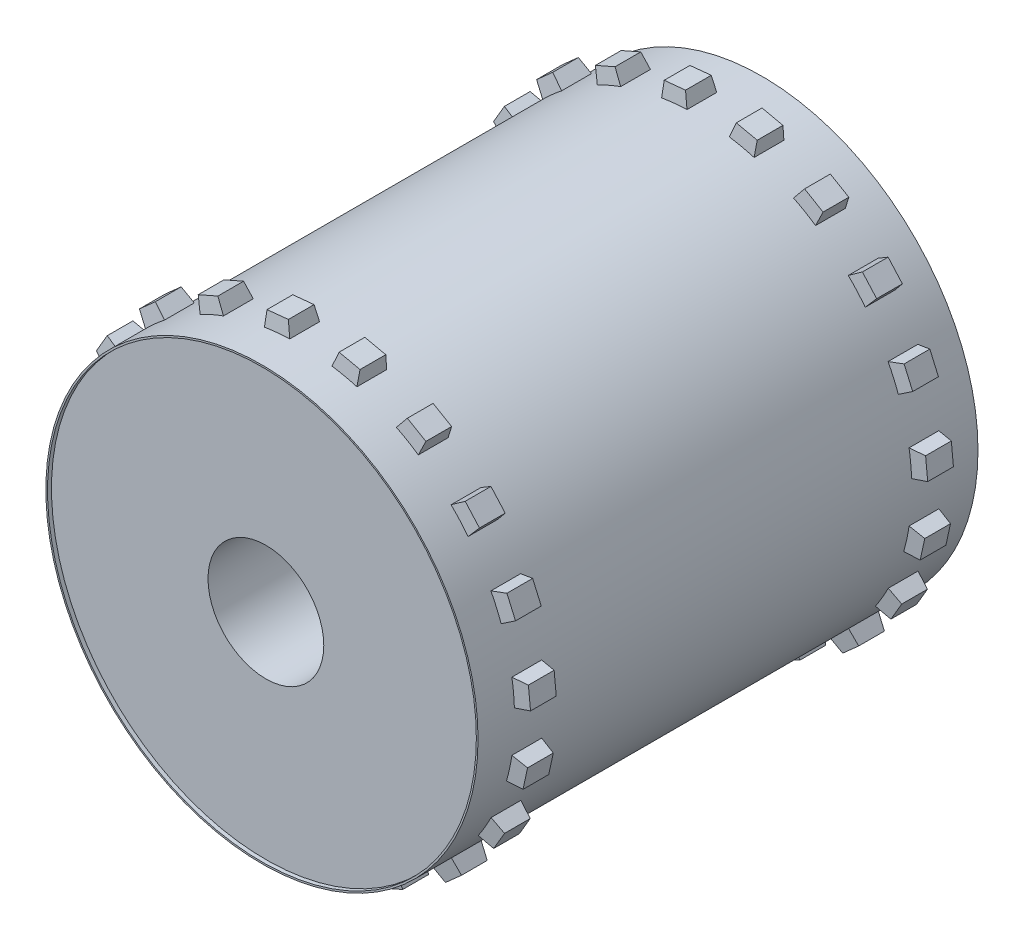
from build123d import *

# Parameters (mm, degrees)
PROFILE_SKETCH_R           = 15.12
PROFILE_EXTRUDE_DEPTH      = 34.98
BORE_SKETCH_R              = 4.05
BORE_CUT_DEPTH             = 41.99791702
BEARING_POCKET_1_SKETCH_R  = 15.00189
BEARING_POCKET_1_CUT_DEPTH = 0.275787
BEARING_START              = -0.275787
BEARING_POCKET_2_SKETCH_R  = 15.00189
BEARING_POCKET_2_CUT_DEPTH = 0.275787
BOSS_EXTRUDE1_DEPTH        = 1.8
DRAFT1_ANGLE               = 8


with BuildPart() as part:
    # Profile Sketch → Profile Extrude (new body)
    with BuildSketch(Plane.XY):
        Circle(PROFILE_SKETCH_R)
    extrude(amount=PROFILE_EXTRUDE_DEPTH)

    # Bore Sketch → Bore Cut (cut, through all)
    with BuildSketch(Plane(origin=(0, 0, 0), x_dir=(-1, 0, 0), z_dir=(0, 0, -1))):
        Circle(BORE_SKETCH_R)
    extrude(amount=-BORE_CUT_DEPTH, mode=Mode.SUBTRACT)

    # Bearing Pocket 1 Sketch → Bearing Pocket 1 Cut (cut)
    with BuildSketch(Plane(origin=(0, 0, 0), x_dir=(-1, 0, 0), z_dir=(0, 0, -1))):
        Circle(BEARING_POCKET_1_SKETCH_R)
    extrude(amount=-BEARING_POCKET_1_CUT_DEPTH, mode=Mode.SUBTRACT)

    # Bearing Pocket 2 Sketch → Bearing Pocket 2 Cut (cut)
    with BuildSketch(Plane.XY.offset(34.98).offset(BEARING_START)):
        with Locations(Location((0, 0, 0), (0, 0, 180))):
            Circle(BEARING_POCKET_2_SKETCH_R)
    extrude(amount=BEARING_POCKET_2_CUT_DEPTH, mode=Mode.SUBTRACT)

    # 3DSketch1 → Boss-Extrude1 (add)
    with BuildSketch(Plane(origin=(-2.240587225, 14.953065535, 32.285), x_dir=(0.7730799543925518, 0.6343085874528346, 0), z_dir=(0, 0, 1))):
        Polygon((0, 0), (0.554700196, 0.832050294), (1.802775638, 0), (1.248075442, -0.832050294), align=None)
    extrude(amount=-BOSS_EXTRUDE1_DEPTH)

    # Draft1
    draft1_faces = [part.faces().sort_by_distance(p)[0] for p in [
        (-1.544354806, 15.530982586, 30.485),
        (-0.797422995, 15.599035352, 31.385),
        (-1.544354806, 15.530982586, 32.285),
        (-2.290061748, 15.450611785, 31.385),
    ]]
    draft(draft1_faces, Plane(origin=(-2.33953627, 15.948158036, 32.285), x_dir=(0.9950925015264446, 0.09894904449181359, 0), z_dir=(-0.09894904449181359, 0.9950925015264446, 0)), DRAFT1_ANGLE)

    # CirPattern1: read off the stored shape, not the designer's step
    # CirPattern1: loft between two sections, ruled curve by curve
    cirpattern1_from = [
        Edge.make_line((2.349822398, 14.936289188, 30.34337705), (4.091993269, 14.555754569, 30.34337705)),
        Edge.make_line((2.349822398, 14.936289188, 30.34337705), (2.349822398, 14.936289188, 32.42662295)),
        Edge.make_line((2.349822398, 14.936289188, 32.42662295), (4.091993269, 14.555754569, 32.42662295)),
        Edge.make_line((4.091993269, 14.555754569, 30.34337705), (4.091993269, 14.555754569, 32.42662295)),
    ]
    cirpattern1_to = [
        Edge.make_line((2.703220648, 15.89055609, 30.485), (4.168669864, 15.570464549, 30.485)),
        Edge.make_line((2.703220648, 15.89055609, 30.485), (2.703220648, 15.89055609, 32.285)),
        Edge.make_line((2.703220648, 15.89055609, 32.285), (4.168669864, 15.570464549, 32.285)),
        Edge.make_line((4.168669864, 15.570464549, 30.485), (4.168669864, 15.570464549, 32.285)),
    ]
    cirpattern1 = Solid(Shell([*[Face.make_surface_from_curves(cirpattern1_from[k], cirpattern1_to[k]) for k in range(4)], Face(Wire(cirpattern1_from)), Face(Wire(cirpattern1_to))]))
    add(cirpattern1)

    # CirPattern1 2: loft between two sections, ruled curve by curve
    cirpattern1_2_from = [
        Edge.make_line((6.850381096, 13.479120106, 30.34337705), (8.389692391, 12.578849772, 30.34337705)),
        Edge.make_line((6.850381096, 13.479120106, 30.34337705), (6.850381096, 13.479120106, 32.42662295)),
        Edge.make_line((6.850381096, 13.479120106, 32.42662295), (8.389692391, 12.578849772, 32.42662295)),
        Edge.make_line((8.389692391, 12.578849772, 30.34337705), (8.389692391, 12.578849772, 32.42662295)),
    ]
    cirpattern1_2_to = [
        Edge.make_line((7.481367494, 14.277475797, 30.485), (8.776178794, 13.520201939, 30.485)),
        Edge.make_line((7.481367494, 14.277475797, 30.485), (7.481367494, 14.277475797, 32.285)),
        Edge.make_line((7.481367494, 14.277475797, 32.285), (8.776178794, 13.520201939, 32.285)),
        Edge.make_line((8.776178794, 13.520201939, 30.485), (8.776178794, 13.520201939, 32.285)),
    ]
    cirpattern1_2 = Solid(Shell([*[Face.make_surface_from_curves(cirpattern1_2_from[k], cirpattern1_2_to[k]) for k in range(4)], Face(Wire(cirpattern1_2_from)), Face(Wire(cirpattern1_2_to))]))
    add(cirpattern1_2)

    # CirPattern1 3: loft between two sections, ruled curve by curve
    cirpattern1_3_from = [
        Edge.make_line((10.680376763, 10.702520834, 30.34337705), (11.866149968, 9.370639517, 30.34337705)),
        Edge.make_line((10.680376763, 10.702520834, 30.34337705), (10.680376763, 10.702520834, 32.42662295)),
        Edge.make_line((10.680376763, 10.702520834, 32.42662295), (11.866149968, 9.370639517, 32.42662295)),
        Edge.make_line((11.866149968, 9.370639517, 30.34337705), (11.866149968, 9.370639517, 32.42662295)),
    ]
    cirpattern1_3_to = [
        Edge.make_line((11.527185964, 11.266816696, 30.485), (12.524614197, 10.146487763, 30.485)),
        Edge.make_line((11.527185964, 11.266816696, 30.485), (11.527185964, 11.266816696, 32.285)),
        Edge.make_line((11.527185964, 11.266816696, 32.285), (12.524614197, 10.146487763, 32.285)),
        Edge.make_line((12.524614197, 10.146487763, 30.485), (12.524614197, 10.146487763, 32.285)),
    ]
    cirpattern1_3 = Solid(Shell([*[Face.make_surface_from_curves(cirpattern1_3_from[k], cirpattern1_3_to[k]) for k in range(4)], Face(Wire(cirpattern1_3_from)), Face(Wire(cirpattern1_3_to))]))
    add(cirpattern1_3)

    # CirPattern1 4: loft between two sections, ruled curve by curve
    cirpattern1_4_from = [
        Edge.make_line((13.464902737, 6.878284254, 30.34337705), (14.181066109, 5.245165776, 30.34337705)),
        Edge.make_line((13.464902737, 6.878284254, 30.34337705), (13.464902737, 6.878284254, 32.42662295)),
        Edge.make_line((13.464902737, 6.878284254, 32.42662295), (14.181066109, 5.245165776, 32.42662295)),
        Edge.make_line((14.181066109, 5.245165776, 30.34337705), (14.181066109, 5.245165776, 32.42662295)),
    ]
    cirpattern1_4_to = [
        Edge.make_line((14.444643157, 7.153283077, 30.485), (15.047053098, 5.779564669, 30.485)),
        Edge.make_line((14.444643157, 7.153283077, 30.485), (14.444643157, 7.153283077, 32.285)),
        Edge.make_line((14.444643157, 7.153283077, 32.285), (15.047053098, 5.779564669, 32.285)),
        Edge.make_line((15.047053098, 5.779564669, 30.485), (15.047053098, 5.779564669, 32.285)),
    ]
    cirpattern1_4 = Solid(Shell([*[Face.make_surface_from_curves(cirpattern1_4_from[k], cirpattern1_4_to[k]) for k in range(4)], Face(Wire(cirpattern1_4_from)), Face(Wire(cirpattern1_4_to))]))
    add(cirpattern1_4)

    # CirPattern1 5: loft between two sections, ruled curve by curve
    cirpattern1_5_from = [
        Edge.make_line((14.931390216, 2.380753288, 30.34337705), (15.107840694, 0.606258665, 30.34337705)),
        Edge.make_line((14.931390216, 2.380753288, 30.34337705), (14.931390216, 2.380753288, 32.42662295)),
        Edge.make_line((14.931390216, 2.380753288, 32.42662295), (15.107840694, 0.606258665, 32.42662295)),
        Edge.make_line((15.107840694, 0.606258665, 30.34337705), (15.107840694, 0.606258665, 32.42662295)),
    ]
    cirpattern1_5_to = [
        Edge.make_line((15.948158036, 2.33953627, 30.485), (16.096581603, 0.846897517, 30.485)),
        Edge.make_line((15.948158036, 2.33953627, 30.485), (15.948158036, 2.33953627, 32.285)),
        Edge.make_line((15.948158036, 2.33953627, 32.285), (16.096581603, 0.846897517, 32.285)),
        Edge.make_line((16.096581603, 0.846897517, 30.485), (16.096581603, 0.846897517, 32.285)),
    ]
    cirpattern1_5 = Solid(Shell([*[Face.make_surface_from_curves(cirpattern1_5_from[k], cirpattern1_5_to[k]) for k in range(4)], Face(Wire(cirpattern1_5_from)), Face(Wire(cirpattern1_5_to))]))
    add(cirpattern1_5)

    # CirPattern1 6: loft between two sections, ruled curve by curve
    cirpattern1_6_from = [
        Edge.make_line((14.936289188, -2.349822398, 30.34337705), (14.555754569, -4.091993269, 30.34337705)),
        Edge.make_line((14.936289188, -2.349822398, 30.34337705), (14.936289188, -2.349822398, 32.42662295)),
        Edge.make_line((14.936289188, -2.349822398, 32.42662295), (14.555754569, -4.091993269, 32.42662295)),
        Edge.make_line((14.555754569, -4.091993269, 30.34337705), (14.555754569, -4.091993269, 32.42662295)),
    ]
    cirpattern1_6_to = [
        Edge.make_line((15.89055609, -2.703220648, 30.485), (15.570464549, -4.168669864, 30.485)),
        Edge.make_line((15.89055609, -2.703220648, 30.485), (15.89055609, -2.703220648, 32.285)),
        Edge.make_line((15.89055609, -2.703220648, 32.285), (15.570464549, -4.168669864, 32.285)),
        Edge.make_line((15.570464549, -4.168669864, 30.485), (15.570464549, -4.168669864, 32.285)),
    ]
    cirpattern1_6 = Solid(Shell([*[Face.make_surface_from_curves(cirpattern1_6_from[k], cirpattern1_6_to[k]) for k in range(4)], Face(Wire(cirpattern1_6_from)), Face(Wire(cirpattern1_6_to))]))
    add(cirpattern1_6)

    # CirPattern1 7: loft between two sections, ruled curve by curve
    cirpattern1_7_from = [
        Edge.make_line((13.479120106, -6.850381096, 30.34337705), (12.578849772, -8.389692391, 30.34337705)),
        Edge.make_line((13.479120106, -6.850381096, 30.34337705), (13.479120106, -6.850381096, 32.42662295)),
        Edge.make_line((13.479120106, -6.850381096, 32.42662295), (12.578849772, -8.389692391, 32.42662295)),
        Edge.make_line((12.578849772, -8.389692391, 30.34337705), (12.578849772, -8.389692391, 32.42662295)),
    ]
    cirpattern1_7_to = [
        Edge.make_line((14.277475797, -7.481367494, 30.485), (13.520201939, -8.776178794, 30.485)),
        Edge.make_line((14.277475797, -7.481367494, 30.485), (14.277475797, -7.481367494, 32.285)),
        Edge.make_line((14.277475797, -7.481367494, 32.285), (13.520201939, -8.776178794, 32.285)),
        Edge.make_line((13.520201939, -8.776178794, 30.485), (13.520201939, -8.776178794, 32.285)),
    ]
    cirpattern1_7 = Solid(Shell([*[Face.make_surface_from_curves(cirpattern1_7_from[k], cirpattern1_7_to[k]) for k in range(4)], Face(Wire(cirpattern1_7_from)), Face(Wire(cirpattern1_7_to))]))
    add(cirpattern1_7)

    # CirPattern1 8: loft between two sections, ruled curve by curve
    cirpattern1_8_from = [
        Edge.make_line((10.702520834, -10.680376763, 30.34337705), (9.370639517, -11.866149968, 30.34337705)),
        Edge.make_line((10.702520834, -10.680376763, 30.34337705), (10.702520834, -10.680376763, 32.42662295)),
        Edge.make_line((10.702520834, -10.680376763, 32.42662295), (9.370639517, -11.866149968, 32.42662295)),
        Edge.make_line((9.370639517, -11.866149968, 30.34337705), (9.370639517, -11.866149968, 32.42662295)),
    ]
    cirpattern1_8_to = [
        Edge.make_line((11.266816696, -11.527185964, 30.485), (10.146487763, -12.524614197, 30.485)),
        Edge.make_line((11.266816696, -11.527185964, 30.485), (11.266816696, -11.527185964, 32.285)),
        Edge.make_line((11.266816696, -11.527185964, 32.285), (10.146487763, -12.524614197, 32.285)),
        Edge.make_line((10.146487763, -12.524614197, 30.485), (10.146487763, -12.524614197, 32.285)),
    ]
    cirpattern1_8 = Solid(Shell([*[Face.make_surface_from_curves(cirpattern1_8_from[k], cirpattern1_8_to[k]) for k in range(4)], Face(Wire(cirpattern1_8_from)), Face(Wire(cirpattern1_8_to))]))
    add(cirpattern1_8)

    # CirPattern1 9: loft between two sections, ruled curve by curve
    cirpattern1_9_from = [
        Edge.make_line((6.878284254, -13.464902737, 30.34337705), (5.245165776, -14.181066109, 30.34337705)),
        Edge.make_line((6.878284254, -13.464902737, 30.34337705), (6.878284254, -13.464902737, 32.42662295)),
        Edge.make_line((6.878284254, -13.464902737, 32.42662295), (5.245165776, -14.181066109, 32.42662295)),
        Edge.make_line((5.245165776, -14.181066109, 30.34337705), (5.245165776, -14.181066109, 32.42662295)),
    ]
    cirpattern1_9_to = [
        Edge.make_line((7.153283077, -14.444643157, 30.485), (5.779564669, -15.047053098, 30.485)),
        Edge.make_line((7.153283077, -14.444643157, 30.485), (7.153283077, -14.444643157, 32.285)),
        Edge.make_line((7.153283077, -14.444643157, 32.285), (5.779564669, -15.047053098, 32.285)),
        Edge.make_line((5.779564669, -15.047053098, 30.485), (5.779564669, -15.047053098, 32.285)),
    ]
    cirpattern1_9 = Solid(Shell([*[Face.make_surface_from_curves(cirpattern1_9_from[k], cirpattern1_9_to[k]) for k in range(4)], Face(Wire(cirpattern1_9_from)), Face(Wire(cirpattern1_9_to))]))
    add(cirpattern1_9)

    # CirPattern1 10: loft between two sections, ruled curve by curve
    cirpattern1_10_from = [
        Edge.make_line((2.380753288, -14.931390216, 30.34337705), (0.606258665, -15.107840694, 30.34337705)),
        Edge.make_line((2.380753288, -14.931390216, 30.34337705), (2.380753288, -14.931390216, 32.42662295)),
        Edge.make_line((2.380753288, -14.931390216, 32.42662295), (0.606258665, -15.107840694, 32.42662295)),
        Edge.make_line((0.606258665, -15.107840694, 30.34337705), (0.606258665, -15.107840694, 32.42662295)),
    ]
    cirpattern1_10_to = [
        Edge.make_line((2.33953627, -15.948158036, 30.485), (0.846897517, -16.096581603, 30.485)),
        Edge.make_line((2.33953627, -15.948158036, 30.485), (2.33953627, -15.948158036, 32.285)),
        Edge.make_line((2.33953627, -15.948158036, 32.285), (0.846897517, -16.096581603, 32.285)),
        Edge.make_line((0.846897517, -16.096581603, 30.485), (0.846897517, -16.096581603, 32.285)),
    ]
    cirpattern1_10 = Solid(Shell([*[Face.make_surface_from_curves(cirpattern1_10_from[k], cirpattern1_10_to[k]) for k in range(4)], Face(Wire(cirpattern1_10_from)), Face(Wire(cirpattern1_10_to))]))
    add(cirpattern1_10)

    # CirPattern1 11: loft between two sections, ruled curve by curve
    cirpattern1_11_from = [
        Edge.make_line((-2.703220648, -15.89055609, 30.485), (-4.168669864, -15.570464549, 30.485)),
        Edge.make_line((-2.703220648, -15.89055609, 30.485), (-2.703220648, -15.89055609, 32.285)),
        Edge.make_line((-2.703220648, -15.89055609, 32.285), (-4.168669864, -15.570464549, 32.285)),
        Edge.make_line((-4.168669864, -15.570464549, 30.485), (-4.168669864, -15.570464549, 32.285)),
    ]
    cirpattern1_11_to = [
        Edge.make_line((-2.349822398, -14.936289188, 30.34337705), (-4.091993269, -14.555754569, 30.34337705)),
        Edge.make_line((-2.349822398, -14.936289188, 30.34337705), (-2.349822398, -14.936289188, 32.42662295)),
        Edge.make_line((-2.349822398, -14.936289188, 32.42662295), (-4.091993269, -14.555754569, 32.42662295)),
        Edge.make_line((-4.091993269, -14.555754569, 30.34337705), (-4.091993269, -14.555754569, 32.42662295)),
    ]
    cirpattern1_11 = Solid(Shell([*[Face.make_surface_from_curves(cirpattern1_11_from[k], cirpattern1_11_to[k]) for k in range(4)], Face(Wire(cirpattern1_11_from)), Face(Wire(cirpattern1_11_to))]))
    add(cirpattern1_11)

    # CirPattern1 12: loft between two sections, ruled curve by curve
    cirpattern1_12_from = [
        Edge.make_line((-7.481367494, -14.277475797, 30.485), (-8.776178794, -13.520201939, 30.485)),
        Edge.make_line((-7.481367494, -14.277475797, 30.485), (-7.481367494, -14.277475797, 32.285)),
        Edge.make_line((-7.481367494, -14.277475797, 32.285), (-8.776178794, -13.520201939, 32.285)),
        Edge.make_line((-8.776178794, -13.520201939, 30.485), (-8.776178794, -13.520201939, 32.285)),
    ]
    cirpattern1_12_to = [
        Edge.make_line((-6.850381096, -13.479120106, 30.34337705), (-8.389692391, -12.578849772, 30.34337705)),
        Edge.make_line((-6.850381096, -13.479120106, 30.34337705), (-6.850381096, -13.479120106, 32.42662295)),
        Edge.make_line((-6.850381096, -13.479120106, 32.42662295), (-8.389692391, -12.578849772, 32.42662295)),
        Edge.make_line((-8.389692391, -12.578849772, 30.34337705), (-8.389692391, -12.578849772, 32.42662295)),
    ]
    cirpattern1_12 = Solid(Shell([*[Face.make_surface_from_curves(cirpattern1_12_from[k], cirpattern1_12_to[k]) for k in range(4)], Face(Wire(cirpattern1_12_from)), Face(Wire(cirpattern1_12_to))]))
    add(cirpattern1_12)

    # CirPattern1 13: loft between two sections, ruled curve by curve
    cirpattern1_13_from = [
        Edge.make_line((-11.527185964, -11.266816696, 30.485), (-12.524614197, -10.146487763, 30.485)),
        Edge.make_line((-11.527185964, -11.266816696, 30.485), (-11.527185964, -11.266816696, 32.285)),
        Edge.make_line((-11.527185964, -11.266816696, 32.285), (-12.524614197, -10.146487763, 32.285)),
        Edge.make_line((-12.524614197, -10.146487763, 30.485), (-12.524614197, -10.146487763, 32.285)),
    ]
    cirpattern1_13_to = [
        Edge.make_line((-10.680376763, -10.702520834, 30.34337705), (-11.866149968, -9.370639517, 30.34337705)),
        Edge.make_line((-10.680376763, -10.702520834, 30.34337705), (-10.680376763, -10.702520834, 32.42662295)),
        Edge.make_line((-10.680376763, -10.702520834, 32.42662295), (-11.866149968, -9.370639517, 32.42662295)),
        Edge.make_line((-11.866149968, -9.370639517, 30.34337705), (-11.866149968, -9.370639517, 32.42662295)),
    ]
    cirpattern1_13 = Solid(Shell([*[Face.make_surface_from_curves(cirpattern1_13_from[k], cirpattern1_13_to[k]) for k in range(4)], Face(Wire(cirpattern1_13_from)), Face(Wire(cirpattern1_13_to))]))
    add(cirpattern1_13)

    # CirPattern1 14: loft between two sections, ruled curve by curve
    cirpattern1_14_from = [
        Edge.make_line((-14.444643157, -7.153283077, 30.485), (-15.047053098, -5.779564669, 30.485)),
        Edge.make_line((-14.444643157, -7.153283077, 30.485), (-14.444643157, -7.153283077, 32.285)),
        Edge.make_line((-14.444643157, -7.153283077, 32.285), (-15.047053098, -5.779564669, 32.285)),
        Edge.make_line((-15.047053098, -5.779564669, 30.485), (-15.047053098, -5.779564669, 32.285)),
    ]
    cirpattern1_14_to = [
        Edge.make_line((-13.464902737, -6.878284254, 30.34337705), (-14.181066109, -5.245165776, 30.34337705)),
        Edge.make_line((-13.464902737, -6.878284254, 30.34337705), (-13.464902737, -6.878284254, 32.42662295)),
        Edge.make_line((-13.464902737, -6.878284254, 32.42662295), (-14.181066109, -5.245165776, 32.42662295)),
        Edge.make_line((-14.181066109, -5.245165776, 30.34337705), (-14.181066109, -5.245165776, 32.42662295)),
    ]
    cirpattern1_14 = Solid(Shell([*[Face.make_surface_from_curves(cirpattern1_14_from[k], cirpattern1_14_to[k]) for k in range(4)], Face(Wire(cirpattern1_14_from)), Face(Wire(cirpattern1_14_to))]))
    add(cirpattern1_14)

    # CirPattern1 15: loft between two sections, ruled curve by curve
    cirpattern1_15_from = [
        Edge.make_line((-15.948158036, -2.33953627, 30.485), (-16.096581603, -0.846897517, 30.485)),
        Edge.make_line((-15.948158036, -2.33953627, 30.485), (-15.948158036, -2.33953627, 32.285)),
        Edge.make_line((-15.948158036, -2.33953627, 32.285), (-16.096581603, -0.846897517, 32.285)),
        Edge.make_line((-16.096581603, -0.846897517, 30.485), (-16.096581603, -0.846897517, 32.285)),
    ]
    cirpattern1_15_to = [
        Edge.make_line((-14.931390216, -2.380753288, 30.34337705), (-15.107840694, -0.606258665, 30.34337705)),
        Edge.make_line((-14.931390216, -2.380753288, 30.34337705), (-14.931390216, -2.380753288, 32.42662295)),
        Edge.make_line((-14.931390216, -2.380753288, 32.42662295), (-15.107840694, -0.606258665, 32.42662295)),
        Edge.make_line((-15.107840694, -0.606258665, 30.34337705), (-15.107840694, -0.606258665, 32.42662295)),
    ]
    cirpattern1_15 = Solid(Shell([*[Face.make_surface_from_curves(cirpattern1_15_from[k], cirpattern1_15_to[k]) for k in range(4)], Face(Wire(cirpattern1_15_from)), Face(Wire(cirpattern1_15_to))]))
    add(cirpattern1_15)

    # CirPattern1 16: loft between two sections, ruled curve by curve
    cirpattern1_16_from = [
        Edge.make_line((-15.89055609, 2.703220648, 30.485), (-15.570464549, 4.168669864, 30.485)),
        Edge.make_line((-15.89055609, 2.703220648, 30.485), (-15.89055609, 2.703220648, 32.285)),
        Edge.make_line((-15.89055609, 2.703220648, 32.285), (-15.570464549, 4.168669864, 32.285)),
        Edge.make_line((-15.570464549, 4.168669864, 30.485), (-15.570464549, 4.168669864, 32.285)),
    ]
    cirpattern1_16_to = [
        Edge.make_line((-14.936289188, 2.349822398, 30.34337705), (-14.555754569, 4.091993269, 30.34337705)),
        Edge.make_line((-14.936289188, 2.349822398, 30.34337705), (-14.936289188, 2.349822398, 32.42662295)),
        Edge.make_line((-14.936289188, 2.349822398, 32.42662295), (-14.555754569, 4.091993269, 32.42662295)),
        Edge.make_line((-14.555754569, 4.091993269, 30.34337705), (-14.555754569, 4.091993269, 32.42662295)),
    ]
    cirpattern1_16 = Solid(Shell([*[Face.make_surface_from_curves(cirpattern1_16_from[k], cirpattern1_16_to[k]) for k in range(4)], Face(Wire(cirpattern1_16_from)), Face(Wire(cirpattern1_16_to))]))
    add(cirpattern1_16)

    # CirPattern1 17: loft between two sections, ruled curve by curve
    cirpattern1_17_from = [
        Edge.make_line((-14.277475797, 7.481367494, 30.485), (-13.520201939, 8.776178794, 30.485)),
        Edge.make_line((-14.277475797, 7.481367494, 30.485), (-14.277475797, 7.481367494, 32.285)),
        Edge.make_line((-14.277475797, 7.481367494, 32.285), (-13.520201939, 8.776178794, 32.285)),
        Edge.make_line((-13.520201939, 8.776178794, 30.485), (-13.520201939, 8.776178794, 32.285)),
    ]
    cirpattern1_17_to = [
        Edge.make_line((-13.479120106, 6.850381096, 30.34337705), (-12.578849772, 8.389692391, 30.34337705)),
        Edge.make_line((-13.479120106, 6.850381096, 30.34337705), (-13.479120106, 6.850381096, 32.42662295)),
        Edge.make_line((-13.479120106, 6.850381096, 32.42662295), (-12.578849772, 8.389692391, 32.42662295)),
        Edge.make_line((-12.578849772, 8.389692391, 30.34337705), (-12.578849772, 8.389692391, 32.42662295)),
    ]
    cirpattern1_17 = Solid(Shell([*[Face.make_surface_from_curves(cirpattern1_17_from[k], cirpattern1_17_to[k]) for k in range(4)], Face(Wire(cirpattern1_17_from)), Face(Wire(cirpattern1_17_to))]))
    add(cirpattern1_17)

    # CirPattern1 18: loft between two sections, ruled curve by curve
    cirpattern1_18_from = [
        Edge.make_line((-11.266816696, 11.527185964, 30.485), (-10.146487763, 12.524614197, 30.485)),
        Edge.make_line((-11.266816696, 11.527185964, 30.485), (-11.266816696, 11.527185964, 32.285)),
        Edge.make_line((-11.266816696, 11.527185964, 32.285), (-10.146487763, 12.524614197, 32.285)),
        Edge.make_line((-10.146487763, 12.524614197, 30.485), (-10.146487763, 12.524614197, 32.285)),
    ]
    cirpattern1_18_to = [
        Edge.make_line((-10.702520834, 10.680376763, 30.34337705), (-9.370639517, 11.866149968, 30.34337705)),
        Edge.make_line((-10.702520834, 10.680376763, 30.34337705), (-10.702520834, 10.680376763, 32.42662295)),
        Edge.make_line((-10.702520834, 10.680376763, 32.42662295), (-9.370639517, 11.866149968, 32.42662295)),
        Edge.make_line((-9.370639517, 11.866149968, 30.34337705), (-9.370639517, 11.866149968, 32.42662295)),
    ]
    cirpattern1_18 = Solid(Shell([*[Face.make_surface_from_curves(cirpattern1_18_from[k], cirpattern1_18_to[k]) for k in range(4)], Face(Wire(cirpattern1_18_from)), Face(Wire(cirpattern1_18_to))]))
    add(cirpattern1_18)

    # CirPattern1 19: loft between two sections, ruled curve by curve
    cirpattern1_19_from = [
        Edge.make_line((-7.153283077, 14.444643157, 30.485), (-5.779564669, 15.047053098, 30.485)),
        Edge.make_line((-7.153283077, 14.444643157, 30.485), (-7.153283077, 14.444643157, 32.285)),
        Edge.make_line((-7.153283077, 14.444643157, 32.285), (-5.779564669, 15.047053098, 32.285)),
        Edge.make_line((-5.779564669, 15.047053098, 30.485), (-5.779564669, 15.047053098, 32.285)),
    ]
    cirpattern1_19_to = [
        Edge.make_line((-6.878284254, 13.464902737, 30.34337705), (-5.245165776, 14.181066109, 30.34337705)),
        Edge.make_line((-6.878284254, 13.464902737, 30.34337705), (-6.878284254, 13.464902737, 32.42662295)),
        Edge.make_line((-6.878284254, 13.464902737, 32.42662295), (-5.245165776, 14.181066109, 32.42662295)),
        Edge.make_line((-5.245165776, 14.181066109, 30.34337705), (-5.245165776, 14.181066109, 32.42662295)),
    ]
    cirpattern1_19 = Solid(Shell([*[Face.make_surface_from_curves(cirpattern1_19_from[k], cirpattern1_19_to[k]) for k in range(4)], Face(Wire(cirpattern1_19_from)), Face(Wire(cirpattern1_19_to))]))
    add(cirpattern1_19)

    # Mirror1: read off the stored shape, not the designer's step
    # Mirror1: loft between two sections, ruled curve by curve
    mirror1_from = [
        Edge.make_line((-2.380753288, 14.931390216, 4.636622806), (-2.380753288, 14.931390216, 2.553376906)),
        Edge.make_line((-0.606258665, 15.107840694, 4.636622806), (-0.606258665, 15.107840694, 2.553376906)),
        Edge.make_line((-0.606258665, 15.107840694, 4.636622806), (-2.380753288, 14.931390216, 4.636622806)),
        Edge.make_line((-2.380753288, 14.931390216, 2.553376906), (-0.606258665, 15.107840694, 2.553376906)),
    ]
    mirror1_to = [
        Edge.make_line((-2.33953627, 15.948158036, 4.494999856), (-2.33953627, 15.948158036, 2.694999856)),
        Edge.make_line((-0.846897517, 16.096581603, 4.494999856), (-0.846897517, 16.096581603, 2.694999856)),
        Edge.make_line((-0.846897517, 16.096581603, 4.494999856), (-2.33953627, 15.948158036, 4.494999856)),
        Edge.make_line((-2.33953627, 15.948158036, 2.694999856), (-0.846897517, 16.096581603, 2.694999856)),
    ]
    mirror1 = Solid(Shell([*[Face.make_surface_from_curves(mirror1_from[k], mirror1_to[k]) for k in range(4)], Face(Wire(mirror1_from)), Face(Wire(mirror1_to))]))
    add(mirror1)

    # Mirror1 2: loft between two sections, ruled curve by curve
    mirror1_2_from = [
        Edge.make_line((2.349822398, 14.936289188, 4.636622806), (2.349822398, 14.936289188, 2.553376906)),
        Edge.make_line((4.091993269, 14.555754569, 4.636622806), (4.091993269, 14.555754569, 2.553376906)),
        Edge.make_line((4.091993269, 14.555754569, 4.636622806), (2.349822398, 14.936289188, 4.636622806)),
        Edge.make_line((2.349822398, 14.936289188, 2.553376906), (4.091993269, 14.555754569, 2.553376906)),
    ]
    mirror1_2_to = [
        Edge.make_line((2.703220648, 15.89055609, 4.494999856), (2.703220648, 15.89055609, 2.694999856)),
        Edge.make_line((4.168669864, 15.570464549, 4.494999856), (4.168669864, 15.570464549, 2.694999856)),
        Edge.make_line((4.168669864, 15.570464549, 4.494999856), (2.703220648, 15.89055609, 4.494999856)),
        Edge.make_line((2.703220648, 15.89055609, 2.694999856), (4.168669864, 15.570464549, 2.694999856)),
    ]
    mirror1_2 = Solid(Shell([*[Face.make_surface_from_curves(mirror1_2_from[k], mirror1_2_to[k]) for k in range(4)], Face(Wire(mirror1_2_from)), Face(Wire(mirror1_2_to))]))
    add(mirror1_2)

    # Mirror1 3: loft between two sections, ruled curve by curve
    mirror1_3_from = [
        Edge.make_line((6.850381096, 13.479120106, 4.636622806), (6.850381096, 13.479120106, 2.553376906)),
        Edge.make_line((8.389692391, 12.578849772, 4.636622806), (8.389692391, 12.578849772, 2.553376906)),
        Edge.make_line((8.389692391, 12.578849772, 4.636622806), (6.850381096, 13.479120106, 4.636622806)),
        Edge.make_line((6.850381096, 13.479120106, 2.553376906), (8.389692391, 12.578849772, 2.553376906)),
    ]
    mirror1_3_to = [
        Edge.make_line((7.481367494, 14.277475797, 4.494999856), (7.481367494, 14.277475797, 2.694999856)),
        Edge.make_line((8.776178794, 13.520201939, 4.494999856), (8.776178794, 13.520201939, 2.694999856)),
        Edge.make_line((8.776178794, 13.520201939, 4.494999856), (7.481367494, 14.277475797, 4.494999856)),
        Edge.make_line((7.481367494, 14.277475797, 2.694999856), (8.776178794, 13.520201939, 2.694999856)),
    ]
    mirror1_3 = Solid(Shell([*[Face.make_surface_from_curves(mirror1_3_from[k], mirror1_3_to[k]) for k in range(4)], Face(Wire(mirror1_3_from)), Face(Wire(mirror1_3_to))]))
    add(mirror1_3)

    # Mirror1 4: loft between two sections, ruled curve by curve
    mirror1_4_from = [
        Edge.make_line((10.680376763, 10.702520834, 4.636622806), (10.680376763, 10.702520834, 2.553376906)),
        Edge.make_line((11.866149968, 9.370639517, 4.636622806), (11.866149968, 9.370639517, 2.553376906)),
        Edge.make_line((11.866149968, 9.370639517, 4.636622806), (10.680376763, 10.702520834, 4.636622806)),
        Edge.make_line((10.680376763, 10.702520834, 2.553376906), (11.866149968, 9.370639517, 2.553376906)),
    ]
    mirror1_4_to = [
        Edge.make_line((11.527185964, 11.266816696, 4.494999856), (11.527185964, 11.266816696, 2.694999856)),
        Edge.make_line((12.524614197, 10.146487763, 4.494999856), (12.524614197, 10.146487763, 2.694999856)),
        Edge.make_line((12.524614197, 10.146487763, 4.494999856), (11.527185964, 11.266816696, 4.494999856)),
        Edge.make_line((11.527185964, 11.266816696, 2.694999856), (12.524614197, 10.146487763, 2.694999856)),
    ]
    mirror1_4 = Solid(Shell([*[Face.make_surface_from_curves(mirror1_4_from[k], mirror1_4_to[k]) for k in range(4)], Face(Wire(mirror1_4_from)), Face(Wire(mirror1_4_to))]))
    add(mirror1_4)

    # Mirror1 5: loft between two sections, ruled curve by curve
    mirror1_5_from = [
        Edge.make_line((13.464902737, 6.878284254, 4.636622806), (13.464902737, 6.878284254, 2.553376906)),
        Edge.make_line((14.181066109, 5.245165776, 4.636622806), (14.181066109, 5.245165776, 2.553376906)),
        Edge.make_line((14.181066109, 5.245165776, 4.636622806), (13.464902737, 6.878284254, 4.636622806)),
        Edge.make_line((13.464902737, 6.878284254, 2.553376906), (14.181066109, 5.245165776, 2.553376906)),
    ]
    mirror1_5_to = [
        Edge.make_line((14.444643157, 7.153283077, 4.494999856), (14.444643157, 7.153283077, 2.694999856)),
        Edge.make_line((15.047053098, 5.779564669, 4.494999856), (15.047053098, 5.779564669, 2.694999856)),
        Edge.make_line((15.047053098, 5.779564669, 4.494999856), (14.444643157, 7.153283077, 4.494999856)),
        Edge.make_line((14.444643157, 7.153283077, 2.694999856), (15.047053098, 5.779564669, 2.694999856)),
    ]
    mirror1_5 = Solid(Shell([*[Face.make_surface_from_curves(mirror1_5_from[k], mirror1_5_to[k]) for k in range(4)], Face(Wire(mirror1_5_from)), Face(Wire(mirror1_5_to))]))
    add(mirror1_5)

    # Mirror1 6: loft between two sections, ruled curve by curve
    mirror1_6_from = [
        Edge.make_line((14.931390216, 2.380753288, 4.636622806), (14.931390216, 2.380753288, 2.553376906)),
        Edge.make_line((15.107840694, 0.606258665, 4.636622806), (15.107840694, 0.606258665, 2.553376906)),
        Edge.make_line((15.107840694, 0.606258665, 4.636622806), (14.931390216, 2.380753288, 4.636622806)),
        Edge.make_line((14.931390216, 2.380753288, 2.553376906), (15.107840694, 0.606258665, 2.553376906)),
    ]
    mirror1_6_to = [
        Edge.make_line((15.948158036, 2.33953627, 4.494999856), (15.948158036, 2.33953627, 2.694999856)),
        Edge.make_line((16.096581603, 0.846897517, 4.494999856), (16.096581603, 0.846897517, 2.694999856)),
        Edge.make_line((16.096581603, 0.846897517, 4.494999856), (15.948158036, 2.33953627, 4.494999856)),
        Edge.make_line((15.948158036, 2.33953627, 2.694999856), (16.096581603, 0.846897517, 2.694999856)),
    ]
    mirror1_6 = Solid(Shell([*[Face.make_surface_from_curves(mirror1_6_from[k], mirror1_6_to[k]) for k in range(4)], Face(Wire(mirror1_6_from)), Face(Wire(mirror1_6_to))]))
    add(mirror1_6)

    # Mirror1 7: loft between two sections, ruled curve by curve
    mirror1_7_from = [
        Edge.make_line((14.936289188, -2.349822398, 4.636622806), (14.936289188, -2.349822398, 2.553376906)),
        Edge.make_line((14.555754569, -4.091993269, 4.636622806), (14.555754569, -4.091993269, 2.553376906)),
        Edge.make_line((14.555754569, -4.091993269, 4.636622806), (14.936289188, -2.349822398, 4.636622806)),
        Edge.make_line((14.936289188, -2.349822398, 2.553376906), (14.555754569, -4.091993269, 2.553376906)),
    ]
    mirror1_7_to = [
        Edge.make_line((15.89055609, -2.703220648, 4.494999856), (15.89055609, -2.703220648, 2.694999856)),
        Edge.make_line((15.570464549, -4.168669864, 4.494999856), (15.570464549, -4.168669864, 2.694999856)),
        Edge.make_line((15.570464549, -4.168669864, 4.494999856), (15.89055609, -2.703220648, 4.494999856)),
        Edge.make_line((15.89055609, -2.703220648, 2.694999856), (15.570464549, -4.168669864, 2.694999856)),
    ]
    mirror1_7 = Solid(Shell([*[Face.make_surface_from_curves(mirror1_7_from[k], mirror1_7_to[k]) for k in range(4)], Face(Wire(mirror1_7_from)), Face(Wire(mirror1_7_to))]))
    add(mirror1_7)

    # Mirror1 8: loft between two sections, ruled curve by curve
    mirror1_8_from = [
        Edge.make_line((13.479120106, -6.850381096, 4.636622806), (13.479120106, -6.850381096, 2.553376906)),
        Edge.make_line((12.578849772, -8.389692391, 4.636622806), (12.578849772, -8.389692391, 2.553376906)),
        Edge.make_line((12.578849772, -8.389692391, 4.636622806), (13.479120106, -6.850381096, 4.636622806)),
        Edge.make_line((13.479120106, -6.850381096, 2.553376906), (12.578849772, -8.389692391, 2.553376906)),
    ]
    mirror1_8_to = [
        Edge.make_line((14.277475797, -7.481367494, 4.494999856), (14.277475797, -7.481367494, 2.694999856)),
        Edge.make_line((13.520201939, -8.776178794, 4.494999856), (13.520201939, -8.776178794, 2.694999856)),
        Edge.make_line((13.520201939, -8.776178794, 4.494999856), (14.277475797, -7.481367494, 4.494999856)),
        Edge.make_line((14.277475797, -7.481367494, 2.694999856), (13.520201939, -8.776178794, 2.694999856)),
    ]
    mirror1_8 = Solid(Shell([*[Face.make_surface_from_curves(mirror1_8_from[k], mirror1_8_to[k]) for k in range(4)], Face(Wire(mirror1_8_from)), Face(Wire(mirror1_8_to))]))
    add(mirror1_8)

    # Mirror1 9: loft between two sections, ruled curve by curve
    mirror1_9_from = [
        Edge.make_line((10.702520834, -10.680376763, 4.636622806), (10.702520834, -10.680376763, 2.553376906)),
        Edge.make_line((9.370639517, -11.866149968, 4.636622806), (9.370639517, -11.866149968, 2.553376906)),
        Edge.make_line((9.370639517, -11.866149968, 4.636622806), (10.702520834, -10.680376763, 4.636622806)),
        Edge.make_line((10.702520834, -10.680376763, 2.553376906), (9.370639517, -11.866149968, 2.553376906)),
    ]
    mirror1_9_to = [
        Edge.make_line((11.266816696, -11.527185964, 4.494999856), (11.266816696, -11.527185964, 2.694999856)),
        Edge.make_line((10.146487763, -12.524614197, 4.494999856), (10.146487763, -12.524614197, 2.694999856)),
        Edge.make_line((10.146487763, -12.524614197, 4.494999856), (11.266816696, -11.527185964, 4.494999856)),
        Edge.make_line((11.266816696, -11.527185964, 2.694999856), (10.146487763, -12.524614197, 2.694999856)),
    ]
    mirror1_9 = Solid(Shell([*[Face.make_surface_from_curves(mirror1_9_from[k], mirror1_9_to[k]) for k in range(4)], Face(Wire(mirror1_9_from)), Face(Wire(mirror1_9_to))]))
    add(mirror1_9)

    # Mirror1 10: loft between two sections, ruled curve by curve
    mirror1_10_from = [
        Edge.make_line((6.878284254, -13.464902737, 4.636622806), (6.878284254, -13.464902737, 2.553376906)),
        Edge.make_line((5.245165776, -14.181066109, 4.636622806), (5.245165776, -14.181066109, 2.553376906)),
        Edge.make_line((5.245165776, -14.181066109, 4.636622806), (6.878284254, -13.464902737, 4.636622806)),
        Edge.make_line((6.878284254, -13.464902737, 2.553376906), (5.245165776, -14.181066109, 2.553376906)),
    ]
    mirror1_10_to = [
        Edge.make_line((7.153283077, -14.444643157, 4.494999856), (7.153283077, -14.444643157, 2.694999856)),
        Edge.make_line((5.779564669, -15.047053098, 4.494999856), (5.779564669, -15.047053098, 2.694999856)),
        Edge.make_line((5.779564669, -15.047053098, 4.494999856), (7.153283077, -14.444643157, 4.494999856)),
        Edge.make_line((7.153283077, -14.444643157, 2.694999856), (5.779564669, -15.047053098, 2.694999856)),
    ]
    mirror1_10 = Solid(Shell([*[Face.make_surface_from_curves(mirror1_10_from[k], mirror1_10_to[k]) for k in range(4)], Face(Wire(mirror1_10_from)), Face(Wire(mirror1_10_to))]))
    add(mirror1_10)

    # Mirror1 11: loft between two sections, ruled curve by curve
    mirror1_11_from = [
        Edge.make_line((2.33953627, -15.948158036, 4.494999856), (2.33953627, -15.948158036, 2.694999856)),
        Edge.make_line((0.846897517, -16.096581603, 4.494999856), (0.846897517, -16.096581603, 2.694999856)),
        Edge.make_line((0.846897517, -16.096581603, 4.494999856), (2.33953627, -15.948158036, 4.494999856)),
        Edge.make_line((2.33953627, -15.948158036, 2.694999856), (0.846897517, -16.096581603, 2.694999856)),
    ]
    mirror1_11_to = [
        Edge.make_line((2.380753288, -14.931390216, 4.636622806), (2.380753288, -14.931390216, 2.553376906)),
        Edge.make_line((0.606258665, -15.107840694, 4.636622806), (0.606258665, -15.107840694, 2.553376906)),
        Edge.make_line((0.606258665, -15.107840694, 4.636622806), (2.380753288, -14.931390216, 4.636622806)),
        Edge.make_line((2.380753288, -14.931390216, 2.553376906), (0.606258665, -15.107840694, 2.553376906)),
    ]
    mirror1_11 = Solid(Shell([*[Face.make_surface_from_curves(mirror1_11_from[k], mirror1_11_to[k]) for k in range(4)], Face(Wire(mirror1_11_from)), Face(Wire(mirror1_11_to))]))
    add(mirror1_11)

    # Mirror1 12: loft between two sections, ruled curve by curve
    mirror1_12_from = [
        Edge.make_line((-2.703220648, -15.89055609, 4.494999856), (-2.703220648, -15.89055609, 2.694999856)),
        Edge.make_line((-4.168669864, -15.570464549, 4.494999856), (-4.168669864, -15.570464549, 2.694999856)),
        Edge.make_line((-4.168669864, -15.570464549, 4.494999856), (-2.703220648, -15.89055609, 4.494999856)),
        Edge.make_line((-2.703220648, -15.89055609, 2.694999856), (-4.168669864, -15.570464549, 2.694999856)),
    ]
    mirror1_12_to = [
        Edge.make_line((-2.349822398, -14.936289188, 4.636622806), (-2.349822398, -14.936289188, 2.553376906)),
        Edge.make_line((-4.091993269, -14.555754569, 4.636622806), (-4.091993269, -14.555754569, 2.553376906)),
        Edge.make_line((-4.091993269, -14.555754569, 4.636622806), (-2.349822398, -14.936289188, 4.636622806)),
        Edge.make_line((-2.349822398, -14.936289188, 2.553376906), (-4.091993269, -14.555754569, 2.553376906)),
    ]
    mirror1_12 = Solid(Shell([*[Face.make_surface_from_curves(mirror1_12_from[k], mirror1_12_to[k]) for k in range(4)], Face(Wire(mirror1_12_from)), Face(Wire(mirror1_12_to))]))
    add(mirror1_12)

    # Mirror1 13: loft between two sections, ruled curve by curve
    mirror1_13_from = [
        Edge.make_line((-7.481367494, -14.277475797, 4.494999856), (-7.481367494, -14.277475797, 2.694999856)),
        Edge.make_line((-8.776178794, -13.520201939, 4.494999856), (-8.776178794, -13.520201939, 2.694999856)),
        Edge.make_line((-8.776178794, -13.520201939, 4.494999856), (-7.481367494, -14.277475797, 4.494999856)),
        Edge.make_line((-7.481367494, -14.277475797, 2.694999856), (-8.776178794, -13.520201939, 2.694999856)),
    ]
    mirror1_13_to = [
        Edge.make_line((-6.850381096, -13.479120106, 4.636622806), (-6.850381096, -13.479120106, 2.553376906)),
        Edge.make_line((-8.389692391, -12.578849772, 4.636622806), (-8.389692391, -12.578849772, 2.553376906)),
        Edge.make_line((-8.389692391, -12.578849772, 4.636622806), (-6.850381096, -13.479120106, 4.636622806)),
        Edge.make_line((-6.850381096, -13.479120106, 2.553376906), (-8.389692391, -12.578849772, 2.553376906)),
    ]
    mirror1_13 = Solid(Shell([*[Face.make_surface_from_curves(mirror1_13_from[k], mirror1_13_to[k]) for k in range(4)], Face(Wire(mirror1_13_from)), Face(Wire(mirror1_13_to))]))
    add(mirror1_13)

    # Mirror1 14: loft between two sections, ruled curve by curve
    mirror1_14_from = [
        Edge.make_line((-11.527185964, -11.266816696, 4.494999856), (-11.527185964, -11.266816696, 2.694999856)),
        Edge.make_line((-12.524614197, -10.146487763, 4.494999856), (-12.524614197, -10.146487763, 2.694999856)),
        Edge.make_line((-12.524614197, -10.146487763, 4.494999856), (-11.527185964, -11.266816696, 4.494999856)),
        Edge.make_line((-11.527185964, -11.266816696, 2.694999856), (-12.524614197, -10.146487763, 2.694999856)),
    ]
    mirror1_14_to = [
        Edge.make_line((-10.680376763, -10.702520834, 4.636622806), (-10.680376763, -10.702520834, 2.553376906)),
        Edge.make_line((-11.866149968, -9.370639517, 4.636622806), (-11.866149968, -9.370639517, 2.553376906)),
        Edge.make_line((-11.866149968, -9.370639517, 4.636622806), (-10.680376763, -10.702520834, 4.636622806)),
        Edge.make_line((-10.680376763, -10.702520834, 2.553376906), (-11.866149968, -9.370639517, 2.553376906)),
    ]
    mirror1_14 = Solid(Shell([*[Face.make_surface_from_curves(mirror1_14_from[k], mirror1_14_to[k]) for k in range(4)], Face(Wire(mirror1_14_from)), Face(Wire(mirror1_14_to))]))
    add(mirror1_14)

    # Mirror1 15: loft between two sections, ruled curve by curve
    mirror1_15_from = [
        Edge.make_line((-14.444643157, -7.153283077, 4.494999856), (-14.444643157, -7.153283077, 2.694999856)),
        Edge.make_line((-15.047053098, -5.779564669, 4.494999856), (-15.047053098, -5.779564669, 2.694999856)),
        Edge.make_line((-15.047053098, -5.779564669, 4.494999856), (-14.444643157, -7.153283077, 4.494999856)),
        Edge.make_line((-14.444643157, -7.153283077, 2.694999856), (-15.047053098, -5.779564669, 2.694999856)),
    ]
    mirror1_15_to = [
        Edge.make_line((-13.464902737, -6.878284254, 4.636622806), (-13.464902737, -6.878284254, 2.553376906)),
        Edge.make_line((-14.181066109, -5.245165776, 4.636622806), (-14.181066109, -5.245165776, 2.553376906)),
        Edge.make_line((-14.181066109, -5.245165776, 4.636622806), (-13.464902737, -6.878284254, 4.636622806)),
        Edge.make_line((-13.464902737, -6.878284254, 2.553376906), (-14.181066109, -5.245165776, 2.553376906)),
    ]
    mirror1_15 = Solid(Shell([*[Face.make_surface_from_curves(mirror1_15_from[k], mirror1_15_to[k]) for k in range(4)], Face(Wire(mirror1_15_from)), Face(Wire(mirror1_15_to))]))
    add(mirror1_15)

    # Mirror1 16: loft between two sections, ruled curve by curve
    mirror1_16_from = [
        Edge.make_line((-15.948158036, -2.33953627, 4.494999856), (-15.948158036, -2.33953627, 2.694999856)),
        Edge.make_line((-16.096581603, -0.846897517, 4.494999856), (-16.096581603, -0.846897517, 2.694999856)),
        Edge.make_line((-16.096581603, -0.846897517, 4.494999856), (-15.948158036, -2.33953627, 4.494999856)),
        Edge.make_line((-15.948158036, -2.33953627, 2.694999856), (-16.096581603, -0.846897517, 2.694999856)),
    ]
    mirror1_16_to = [
        Edge.make_line((-14.931390216, -2.380753288, 4.636622806), (-14.931390216, -2.380753288, 2.553376906)),
        Edge.make_line((-15.107840694, -0.606258665, 4.636622806), (-15.107840694, -0.606258665, 2.553376906)),
        Edge.make_line((-15.107840694, -0.606258665, 4.636622806), (-14.931390216, -2.380753288, 4.636622806)),
        Edge.make_line((-14.931390216, -2.380753288, 2.553376906), (-15.107840694, -0.606258665, 2.553376906)),
    ]
    mirror1_16 = Solid(Shell([*[Face.make_surface_from_curves(mirror1_16_from[k], mirror1_16_to[k]) for k in range(4)], Face(Wire(mirror1_16_from)), Face(Wire(mirror1_16_to))]))
    add(mirror1_16)

    # Mirror1 17: loft between two sections, ruled curve by curve
    mirror1_17_from = [
        Edge.make_line((-15.89055609, 2.703220648, 4.494999856), (-15.89055609, 2.703220648, 2.694999856)),
        Edge.make_line((-15.570464549, 4.168669864, 4.494999856), (-15.570464549, 4.168669864, 2.694999856)),
        Edge.make_line((-15.570464549, 4.168669864, 4.494999856), (-15.89055609, 2.703220648, 4.494999856)),
        Edge.make_line((-15.89055609, 2.703220648, 2.694999856), (-15.570464549, 4.168669864, 2.694999856)),
    ]
    mirror1_17_to = [
        Edge.make_line((-14.936289188, 2.349822398, 4.636622806), (-14.936289188, 2.349822398, 2.553376906)),
        Edge.make_line((-14.555754569, 4.091993269, 4.636622806), (-14.555754569, 4.091993269, 2.553376906)),
        Edge.make_line((-14.555754569, 4.091993269, 4.636622806), (-14.936289188, 2.349822398, 4.636622806)),
        Edge.make_line((-14.936289188, 2.349822398, 2.553376906), (-14.555754569, 4.091993269, 2.553376906)),
    ]
    mirror1_17 = Solid(Shell([*[Face.make_surface_from_curves(mirror1_17_from[k], mirror1_17_to[k]) for k in range(4)], Face(Wire(mirror1_17_from)), Face(Wire(mirror1_17_to))]))
    add(mirror1_17)

    # Mirror1 18: loft between two sections, ruled curve by curve
    mirror1_18_from = [
        Edge.make_line((-14.277475797, 7.481367494, 4.494999856), (-14.277475797, 7.481367494, 2.694999856)),
        Edge.make_line((-13.520201939, 8.776178794, 4.494999856), (-13.520201939, 8.776178794, 2.694999856)),
        Edge.make_line((-13.520201939, 8.776178794, 4.494999856), (-14.277475797, 7.481367494, 4.494999856)),
        Edge.make_line((-14.277475797, 7.481367494, 2.694999856), (-13.520201939, 8.776178794, 2.694999856)),
    ]
    mirror1_18_to = [
        Edge.make_line((-13.479120106, 6.850381096, 4.636622806), (-13.479120106, 6.850381096, 2.553376906)),
        Edge.make_line((-12.578849772, 8.389692391, 4.636622806), (-12.578849772, 8.389692391, 2.553376906)),
        Edge.make_line((-12.578849772, 8.389692391, 4.636622806), (-13.479120106, 6.850381096, 4.636622806)),
        Edge.make_line((-13.479120106, 6.850381096, 2.553376906), (-12.578849772, 8.389692391, 2.553376906)),
    ]
    mirror1_18 = Solid(Shell([*[Face.make_surface_from_curves(mirror1_18_from[k], mirror1_18_to[k]) for k in range(4)], Face(Wire(mirror1_18_from)), Face(Wire(mirror1_18_to))]))
    add(mirror1_18)

    # Mirror1 19: loft between two sections, ruled curve by curve
    mirror1_19_from = [
        Edge.make_line((-11.266816696, 11.527185964, 4.494999856), (-11.266816696, 11.527185964, 2.694999856)),
        Edge.make_line((-10.146487763, 12.524614197, 4.494999856), (-10.146487763, 12.524614197, 2.694999856)),
        Edge.make_line((-10.146487763, 12.524614197, 4.494999856), (-11.266816696, 11.527185964, 4.494999856)),
        Edge.make_line((-11.266816696, 11.527185964, 2.694999856), (-10.146487763, 12.524614197, 2.694999856)),
    ]
    mirror1_19_to = [
        Edge.make_line((-10.702520834, 10.680376763, 4.636622806), (-10.702520834, 10.680376763, 2.553376906)),
        Edge.make_line((-9.370639517, 11.866149968, 4.636622806), (-9.370639517, 11.866149968, 2.553376906)),
        Edge.make_line((-9.370639517, 11.866149968, 4.636622806), (-10.702520834, 10.680376763, 4.636622806)),
        Edge.make_line((-10.702520834, 10.680376763, 2.553376906), (-9.370639517, 11.866149968, 2.553376906)),
    ]
    mirror1_19 = Solid(Shell([*[Face.make_surface_from_curves(mirror1_19_from[k], mirror1_19_to[k]) for k in range(4)], Face(Wire(mirror1_19_from)), Face(Wire(mirror1_19_to))]))
    add(mirror1_19)

    # Mirror1 20: loft between two sections, ruled curve by curve
    mirror1_20_from = [
        Edge.make_line((-7.153283077, 14.444643157, 4.494999856), (-7.153283077, 14.444643157, 2.694999856)),
        Edge.make_line((-5.779564669, 15.047053098, 4.494999856), (-5.779564669, 15.047053098, 2.694999856)),
        Edge.make_line((-5.779564669, 15.047053098, 4.494999856), (-7.153283077, 14.444643157, 4.494999856)),
        Edge.make_line((-7.153283077, 14.444643157, 2.694999856), (-5.779564669, 15.047053098, 2.694999856)),
    ]
    mirror1_20_to = [
        Edge.make_line((-6.878284254, 13.464902737, 4.636622806), (-6.878284254, 13.464902737, 2.553376906)),
        Edge.make_line((-5.245165776, 14.181066109, 4.636622806), (-5.245165776, 14.181066109, 2.553376906)),
        Edge.make_line((-5.245165776, 14.181066109, 4.636622806), (-6.878284254, 13.464902737, 4.636622806)),
        Edge.make_line((-6.878284254, 13.464902737, 2.553376906), (-5.245165776, 14.181066109, 2.553376906)),
    ]
    mirror1_20 = Solid(Shell([*[Face.make_surface_from_curves(mirror1_20_from[k], mirror1_20_to[k]) for k in range(4)], Face(Wire(mirror1_20_from)), Face(Wire(mirror1_20_to))]))
    add(mirror1_20)


solid = part.part
